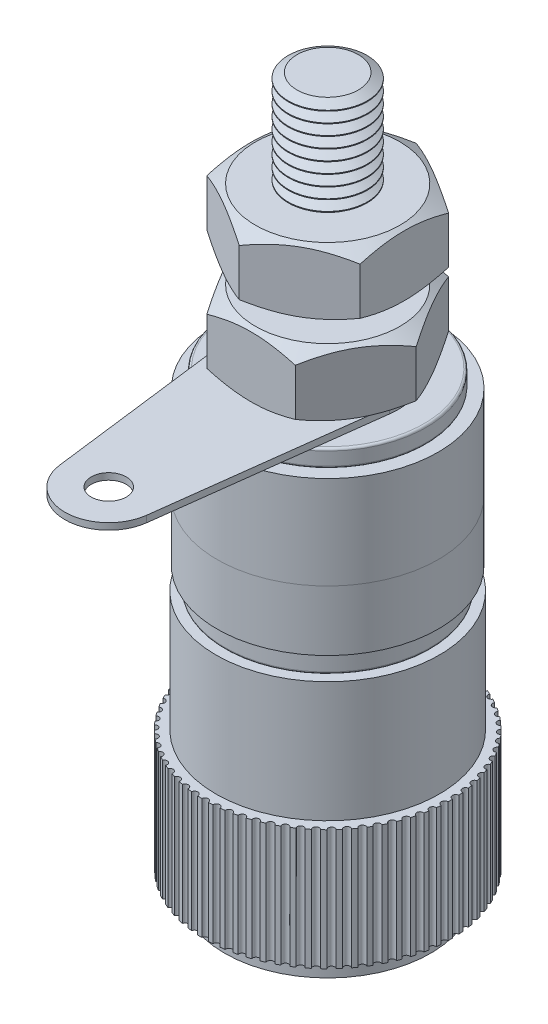
from build123d import *

# Parameters (mm, degrees)
SKETCH1_R           = 4.7
SKETCH1_R_2         = 3.1
BOSS_EXTRUDE1_DEPTH = 1
SKETCH2_R           = 5.6
SKETCH2_R_2         = 3.1
BOSS_EXTRUDE2_DEPTH = 3
SKETCH4_R           = 5.6
SKETCH4_R_2         = 2.25
BOSS_EXTRUDE3_DEPTH = 2.5
SKETCH5_R           = 5.1
SKETCH5_R_2         = 2.25
BOSS_EXTRUDE4_DEPTH = 5.5
LPATTERN1_COUNT     = 30
LPATTERN1_PITCH     = 0.5
SKETCH12_R          = 4.5
SKETCH12_R_2        = 2.2
BOSS_EXTRUDE5_DEPTH = 0.8
BOSS_EXTRUDE6_START = 8
SKETCH13_R          = 2.25
SKETCH13_R_2        = 2.05
BOSS_EXTRUDE6_DEPTH = 8
FILLET1_R           = 0.1
FILLET2_R           = 0.1
FILLET3_R           = 0.1
SKETCH14_R          = 2.1
SKETCH14_R_2        = 0.8
BOSS_EXTRUDE7_DEPTH = 0.3
SKETCH15_R          = 1.625
BOSS_EXTRUDE8_DEPTH = 3
SKETCH17_R          = 1.625
BOSS_EXTRUDE9_DEPTH = 3
SKETCH19_R          = 0.15
CUT_EXTRUDE1_DEPTH  = 5.5
CIRPATTERN1_COUNT   = 70


with BuildPart() as part:
    # Sketch1 → Boss-Extrude1 (new body)
    with BuildSketch(Plane(origin=(0, 0, 0), x_dir=(1, 0, 0), z_dir=(0, 1, 0))):
        with Locations(Location((0, 0, 0), (0, 0, 270))):
            Circle(SKETCH1_R)
        with Locations(Location((0, 0, 0), (0, 0, 270))):
            Circle(SKETCH1_R_2, mode=Mode.SUBTRACT)
    extrude(amount=BOSS_EXTRUDE1_DEPTH)

    # Sketch2 → Boss-Extrude2 (add)
    with BuildSketch(Plane(origin=(0, 1, 0), x_dir=(1, 0, 0), z_dir=(0, 1, 0))):
        with Locations(Location((0, 0, 0), (0, 0, 270))):
            Circle(SKETCH2_R)
        with Locations(Location((0, 0, 0), (0, 0, 270))):
            Circle(SKETCH2_R_2, mode=Mode.SUBTRACT)
    extrude(amount=BOSS_EXTRUDE2_DEPTH)

    # Sketch4 → Boss-Extrude3 (add)
    with BuildSketch(Plane(origin=(0, 4, 0), x_dir=(1, 0, 0), z_dir=(0, 1, 0))):
        with Locations(Location((0, 0, 0), (0, 0, 270))):
            Circle(SKETCH4_R)
        with Locations(Location((0, 0, 0), (0, 0, 270))):
            Circle(SKETCH4_R_2, mode=Mode.SUBTRACT)
    extrude(amount=BOSS_EXTRUDE3_DEPTH)

    # Sketch5 → Boss-Extrude4 (add)
    with BuildSketch(Plane(origin=(0, 6.5, 0), x_dir=(1, 0, 0), z_dir=(0, 1, 0))):
        with Locations(Location((0, 0, 0), (0, 0, 270))):
            Circle(SKETCH5_R)
        with Locations(Location((0, 0, 0), (0, 0, 270))):
            Circle(SKETCH5_R_2, mode=Mode.SUBTRACT)
    extrude(amount=BOSS_EXTRUDE4_DEPTH)

    # Sketch19 → Cut-Extrude1 (cut)
    with BuildSketch(Plane.XZ.offset(-1)):
        with Locations((0, -5.6)):
            Circle(SKETCH19_R)
    cut_extrude1 = extrude(amount=-CUT_EXTRUDE1_DEPTH, mode=Mode.SUBTRACT)

    # CirPattern1: Cut-Extrude1 ×70 about axis
    cirpattern1_axis = Axis((0, 0, 0), (0, 1, 0))
    for i in range(1, CIRPATTERN1_COUNT):
        add(cut_extrude1.rotate(cirpattern1_axis, i * 360 / CIRPATTERN1_COUNT), mode=Mode.SUBTRACT)


with BuildPart() as body_2:
    # Sketch6 → Revolve1 (revolve)
    with BuildSketch(Plane.XY, mode=Mode.PRIVATE) as revolve1_sk:
        Polygon((0, 12), (0, 32.5), (1.8, 32.5), (1.8, 16.75), (2.4, 16.75), (2.4, 13), (4.7, 13), (4.7, 12), align=None)
    revolve(revolve1_sk.sketch.rotate(Axis((0, 0, 0), (0, 1, 0)), 90), axis=Axis((0, 0, 0), (0, 1, 0)))

    # Sketch7 → Cut-Revolve1 (revolve, cut)
    with BuildSketch(Plane.XY):
        with BuildLine():
            Line((0, 12), (0, 14))
            Line((0, 14), (0.55, 14))
            ThreePointArc((0.55, 14), (1.610660172, 13.560660172), (2.05, 12.5))
            Line((2.05, 12.5), (2.05, 12))
            Line((2.05, 12), (0, 12))
        make_face()
    revolve(axis=Axis((0, 0, 0), (0, 1, 0)), mode=Mode.SUBTRACT)

    # Sketch8 → Cut-Revolve2 (revolve, cut)
    with BuildSketch(Plane.XY, mode=Mode.PRIVATE) as cut_revolve2_sk:
        Polygon((2.333012702, 32.75), (2.333012702, 32.25), (1.833012702, 32.25), (1.4, 32.5), (1.833012702, 32.75), align=None)
    cut_revolve2 = revolve(cut_revolve2_sk.sketch.rotate(Axis((0, 0, 0), (0, 1, 0)), 90), axis=Axis((0, 0, 0), (0, 1, 0)), mode=Mode.SUBTRACT)

    # LPattern1: Cut-Revolve2 ×30
    with Locations(*[(0, -i * LPATTERN1_PITCH, 0) for i in range(1, LPATTERN1_COUNT)]):
        add(cut_revolve2, mode=Mode.SUBTRACT)

    # Sketch13 → Boss-Extrude6 (add)
    with BuildSketch(Plane.XZ.offset(-12).offset(BOSS_EXTRUDE6_START)):
        with Locations(Location((0, 0, 0), (0, 0, 90))):
            Circle(SKETCH13_R)
        Circle(SKETCH13_R_2, mode=Mode.SUBTRACT)
    extrude(amount=-BOSS_EXTRUDE6_DEPTH)

    # Fillet1
    fillet1_edges = [body_2.edges().sort_by_distance(p)[0] for p in [
        (0, 4, -2.25),
        (-2.05, 4, 0),
    ]]
    fillet(fillet1_edges, radius=FILLET1_R - 0.0001)  # a hair under: the kernel refuses the full size

    # Fillet2
    fillet2_edges = [body_2.edges().sort_by_distance(p)[0] for p in [
        (0, 12, 4.7),
        (0, 13, 4.7),
    ]]
    fillet(fillet2_edges, radius=FILLET2_R)


with BuildPart() as body_3:
    # Sketch9 → Revolve2 (revolve)
    with BuildSketch(Plane.XY, mode=Mode.PRIVATE) as revolve2_sk:
        Polygon((2.5, 18.25), (4, 18.25), (4, 15.75), (5.05, 15.75), (5.05, 13), (2.5, 13), align=None)
    revolve(revolve2_sk.sketch.rotate(Axis((0, 13, 0), (0, 1, 0)), 90), axis=Axis((0, 13, 0), (0, 1, 0)))


with BuildPart() as body_4:
    # Sketch11 → Revolve4 (revolve)
    with BuildSketch(Plane.XY, mode=Mode.PRIVATE) as revolve4_sk:
        Polygon((2, 18.35), (4.1, 18.35), (4.1, 15.75), (5.05, 15.75), (5.05, 20), (2, 20), align=None)
    revolve(revolve4_sk.sketch.rotate(Axis((0, 18.35, 0), (0, 1, 0)), 90), axis=Axis((0, 18.35, 0), (0, 1, 0)))


with BuildPart() as body_5:
    # Sketch12 → Boss-Extrude5 (new body)
    with BuildSketch(Plane(origin=(0, 20, 0), x_dir=(1, 0, 0), z_dir=(0, 1, 0))):
        with Locations(Location((0, 0, 0), (0, 0, 270))):
            Circle(SKETCH12_R)
        with Locations(Location((0, 0, 0), (0, 0, 270))):
            Circle(SKETCH12_R_2, mode=Mode.SUBTRACT)
    extrude(amount=BOSS_EXTRUDE5_DEPTH)

    # Fillet3
    fillet3_edges = [body_5.edges().sort_by_distance(p)[0] for p in [
        (0, 20, -4.5),
        (0, 20.8, -4.5),
    ]]
    fillet(fillet3_edges, radius=FILLET3_R)


with BuildPart() as body_6:
    # Sketch14 → Boss-Extrude7 (new body)
    with BuildSketch(Plane(origin=(0, 20.8, 0), x_dir=(1, 0, 0), z_dir=(0, 1, 0))):
        with BuildLine():
            Line((-3.22450941, -0.40625), (-1.984313483, -10.25))
            ThreePointArc((-1.984313483, -10.25), (0, -12), (1.984313483, -10.25))
            Line((1.984313483, -10.25), (3.22450941, -0.40625))
            ThreePointArc((3.22450941, -0.40625), (0, 3.25), (-3.22450941, -0.40625))
        make_face()
        with Locations(Location((0, 0, 0), (0, 0, 270))):
            Circle(SKETCH14_R, mode=Mode.SUBTRACT)
        with Locations(Location((0, -10, 0), (0, 0, 270))):
            Circle(SKETCH14_R_2, mode=Mode.SUBTRACT)
    extrude(amount=BOSS_EXTRUDE7_DEPTH)


with BuildPart() as body_7:
    # Sketch15 → Boss-Extrude8 (new body)
    with BuildSketch(Plane(origin=(0, 21.1, 0), x_dir=(1, 0, 0), z_dir=(0, 1, 0))):
        Polygon((4.041451884, 0), (2.020725942, 3.5), (-2.020725942, 3.5), (-4.041451884, 0), (-2.020725942, -3.5), (2.020725942, -3.5), align=None)
        with Locations(Location((0, 0, 0), (0, 0, 270))):
            Circle(SKETCH15_R, mode=Mode.SUBTRACT)
    extrude(amount=BOSS_EXTRUDE8_DEPTH)

    # Sketch16 → Cut-Revolve3 (revolve, cut)
    with BuildSketch(Plane.XY, mode=Mode.PRIVATE) as cut_revolve3_sk:
        Polygon((3.3, 24.1), (4.041451884, 24.1), (4.041451884, 23.671922555), align=None)
        Polygon((3.3, 21.1), (4.041451884, 21.1), (4.041451884, 21.528077445), align=None)
    revolve(cut_revolve3_sk.sketch.rotate(Axis((0, 21.1, 0), (0, 1, 0)), 270), axis=Axis((0, 21.1, 0), (0, 1, 0)), mode=Mode.SUBTRACT)


with BuildPart() as body_8:
    # Sketch17 → Boss-Extrude9 (new body)
    with BuildSketch(Plane(origin=(0, 25.1, 0), x_dir=(1, 0, 0), z_dir=(0, 1, 0))):
        Polygon((3.5, -2.020725942), (3.5, 2.020725942), (0, 4.041451884), (-3.5, 2.020725942), (-3.5, -2.020725942), (0, -4.041451884), align=None)
        with Locations(Location((0, 0, 0), (0, 0, 270))):
            Circle(SKETCH17_R, mode=Mode.SUBTRACT)
    extrude(amount=BOSS_EXTRUDE9_DEPTH)

    # Sketch18 → Cut-Revolve4 (revolve, cut)
    with BuildSketch(Plane(origin=(0, 0, 0), x_dir=(0, 0, -1), z_dir=(1, 0, 0)), mode=Mode.PRIVATE) as cut_revolve4_sk:
        Polygon((3.3, 28.1), (4.041451884, 28.1), (4.041451884, 27.671922555), align=None)
        Polygon((3.3, 25.1), (4.041451884, 25.1), (4.041451884, 25.528077445), align=None)
    revolve(cut_revolve4_sk.sketch.rotate(Axis((0, 25.1, 0), (0, 1, 0)), 209.999999937), axis=Axis((0, 25.1, 0), (0, 1, 0)), mode=Mode.SUBTRACT)


solid = Compound([part.part, body_2.part, body_3.part, body_4.part, body_5.part, body_6.part, body_7.part, body_8.part])
